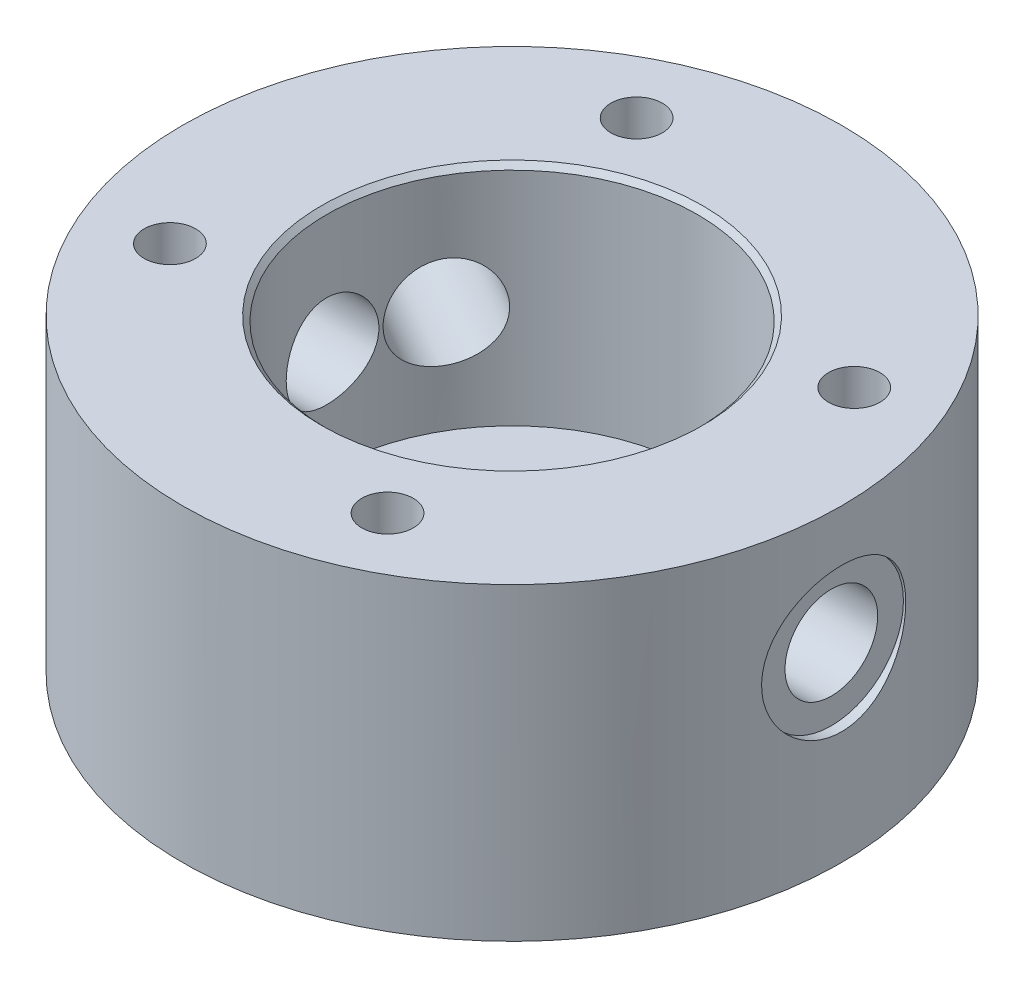
from build123d import *

# Parameters (mm, degrees)
ESBO_O4_W                        = 2.25
ESBO_O4_H                        = 16
F_4_5_4_5_DIAMETER_HOLE2_D       = 4.5
F_4_5_4_5_DIAMETER_HOLE2_DEPTH   = 18
F_4_5_4_5_DIAMETER_HOLE2_TIP     = 1.351936393
ESBO_O12_R                       = 16
ESBO_O12_R_2                     = 9
RESSALTO_EXTRUS_O1_DEPTH         = 1
CHANFRO1_SIZE                    = 0.5
CHANFRO2_SIZE                    = 0.25
FURO_DE_DI_METRO_4_5_4_5_2_D     = 4.5
FURO_DE_DI_METRO_4_5_4_5_2_DEPTH = 8
FURO_DE_DI_METRO_4_5_4_5_2_TIP   = 1.351936393
ESBO_O18_R                       = 3.5
CORTE_EXTRUS_O4_DEPTH            = 0.5
ESBO_O20_R                       = 3.5
CORTE_EXTRUS_O5_DEPTH            = 0.5


# Read off the part's stored shape, not the designer's step: PadrãoCircular5
with BuildPart() as part:
    # Esboço1 → Revolução1 (revolve)
    with BuildSketch(Plane.XY, mode=Mode.PRIVATE) as revolu_o1_sk:
        Polygon((3, -9), (16, -9), (16, 5), (9, 5), (9, -5), (3, -5), align=None)
    revolve(revolu_o1_sk.sketch.rotate(Axis((0, -9, 0), (0, 1, 0)), 90), axis=Axis((0, -9, 0), (0, 1, 0)))

    # Esboço4 → Furo de diâmetro Ø4.5 (4.5)1 (revolve, cut)
    with BuildSketch(Plane(origin=(16, 0, 0), x_dir=(0, 0, -1), z_dir=(0, 1, 0))):
        with Locations((1.125, 8)):
            Rectangle(ESBO_O4_W, ESBO_O4_H)
    revolve(axis=Axis((22.35, 0, 0), (-1, 0, 0)), mode=Mode.SUBTRACT)

    # Ø4.5 (4.5) Diameter Hole2
    with Locations(Plane(origin=(-13.856406461, 0, -8), x_dir=(0, -1, 0), z_dir=(-0.8660254037844364, 0, -0.5000000000000041))):
        with Locations((0, 0)):
            Hole(F_4_5_4_5_DIAMETER_HOLE2_D / 2, depth=F_4_5_4_5_DIAMETER_HOLE2_DEPTH)
            with Locations((0, 0, -(F_4_5_4_5_DIAMETER_HOLE2_DEPTH + F_4_5_4_5_DIAMETER_HOLE2_TIP / 2))):  # 118° drill point
                Cone(0, F_4_5_4_5_DIAMETER_HOLE2_D / 2, F_4_5_4_5_DIAMETER_HOLE2_TIP, mode=Mode.SUBTRACT)

    # Esboço12 → Ressalto-extrusão1 (add)
    with BuildSketch(Plane(origin=(0, 5, 0), x_dir=(1, 0, 0), z_dir=(0, 1, 0))):
        with Locations(Location((0, 0, 0), (0, 0, 90))):
            Circle(ESBO_O12_R)
        with Locations(Location((0, 0, 0), (0, 0, 90))):
            Circle(ESBO_O12_R_2, mode=Mode.SUBTRACT)
    extrude(amount=RESSALTO_EXTRUS_O1_DEPTH)

    # Esboço13 → Furo roscado de M3x0.51 (revolve, cut)
    with BuildSketch(Plane(origin=(11.328847338, 6, -5.282728272), x_dir=(0, 0, 1), z_dir=(1, 0, 0))):
        Polygon((0, 0), (0, 10.751075774), (1.25, 10), (1.25, 0), align=None)
    revolve(axis=Axis((11.328847338, 12.35, -5.282728272), (0, -1, 0)), mode=Mode.SUBTRACT)

    # PadrãoCircular5 outline → PadrãoCircular5 (revolve, cut)
    with BuildSketch(Plane(origin=(5.282728272, 0, 11.328847338), x_dir=(1, 0, 0), z_dir=(0, 0, 1))):
        Polygon((0, 6), (0, -4.751075774), (1.25, -4), (1.25, 6), align=None)
    revolve(axis=Axis((5.282728272, 0, 11.328847338), (0, 1, 0)), mode=Mode.SUBTRACT)

    # Padr_oCircular5 2 outline → Padr_oCircular5 2 (revolve, cut)
    with BuildSketch(Plane(origin=(-11.328847338, 0, 5.282728272), x_dir=(1, 0, 0), z_dir=(0, 0, 1))):
        Polygon((0, 6), (0, -4.751075774), (1.25, -4), (1.25, 6), align=None)
    revolve(axis=Axis((-11.328847338, 0, 5.282728272), (0, 1, 0)), mode=Mode.SUBTRACT)

    # Padr_oCircular5 3 outline → Padr_oCircular5 3 (revolve, cut)
    with BuildSketch(Plane(origin=(-5.282728272, 0, -11.328847338), x_dir=(1, 0, 0), z_dir=(0, 0, 1))):
        Polygon((0, 6), (0, -4.751075774), (1.25, -4), (1.25, 6), align=None)
    revolve(axis=Axis((-5.282728272, 0, -11.328847338), (0, 1, 0)), mode=Mode.SUBTRACT)

    # Chanfro1
    chanfro1_edges = [part.edges().sort_by_distance(p)[0] for p in [
        (0, -5, 3),
    ]]
    chamfer(chanfro1_edges, length=CHANFRO1_SIZE)

    # Chanfro2
    chanfro2_edges = [part.edges().sort_by_distance(p)[0] for p in [
        (0, 6, 9),
    ]]
    chamfer(chanfro2_edges, length=CHANFRO2_SIZE)

    # Furo de diâmetro Ø4.5 (4.5)2
    with Locations(Plane(origin=(-16, 0, 0), x_dir=(0, 0, -1), z_dir=(-1, 0, 0))):
        with Locations((0, 0)):
            Hole(FURO_DE_DI_METRO_4_5_4_5_2_D / 2, depth=FURO_DE_DI_METRO_4_5_4_5_2_DEPTH)
            with Locations((0, 0, -(FURO_DE_DI_METRO_4_5_4_5_2_DEPTH + FURO_DE_DI_METRO_4_5_4_5_2_TIP / 2))):  # 118° drill point
                Cone(0, FURO_DE_DI_METRO_4_5_4_5_2_D / 2, FURO_DE_DI_METRO_4_5_4_5_2_TIP, mode=Mode.SUBTRACT)

    # Esboço18 → Corte-extrusão4 (cut)
    with BuildSketch(Plane(origin=(-16, 0, 0), x_dir=(0, -1, 0), z_dir=(-1, 0, 0))):
        with Locations(Location((0, 0, 0), (0, 0, 90))):
            Circle(ESBO_O18_R)
    corte_extrus_o4 = extrude(amount=-CORTE_EXTRUS_O4_DEPTH, mode=Mode.SUBTRACT)

    # Esboço20 → Corte-extrusão5 (cut)
    with BuildSketch(Plane(origin=(-13.856406461, 0, -8), x_dir=(0, -1, 0), z_dir=(-0.8660254037844364, 0, -0.5000000000000041))):
        with Locations(Location((0, 0, 0), (0, 0, 90))):
            Circle(ESBO_O20_R)
    extrude(amount=-CORTE_EXTRUS_O5_DEPTH, mode=Mode.SUBTRACT)

    # Espelhar1: Corte-extrusão4 across plane
    add(corte_extrus_o4.mirror(Plane(origin=(0, 0, 0), x_dir=(0, 0, 1), z_dir=(1, 0, 0))), mode=Mode.SUBTRACT)


solid = part.part
